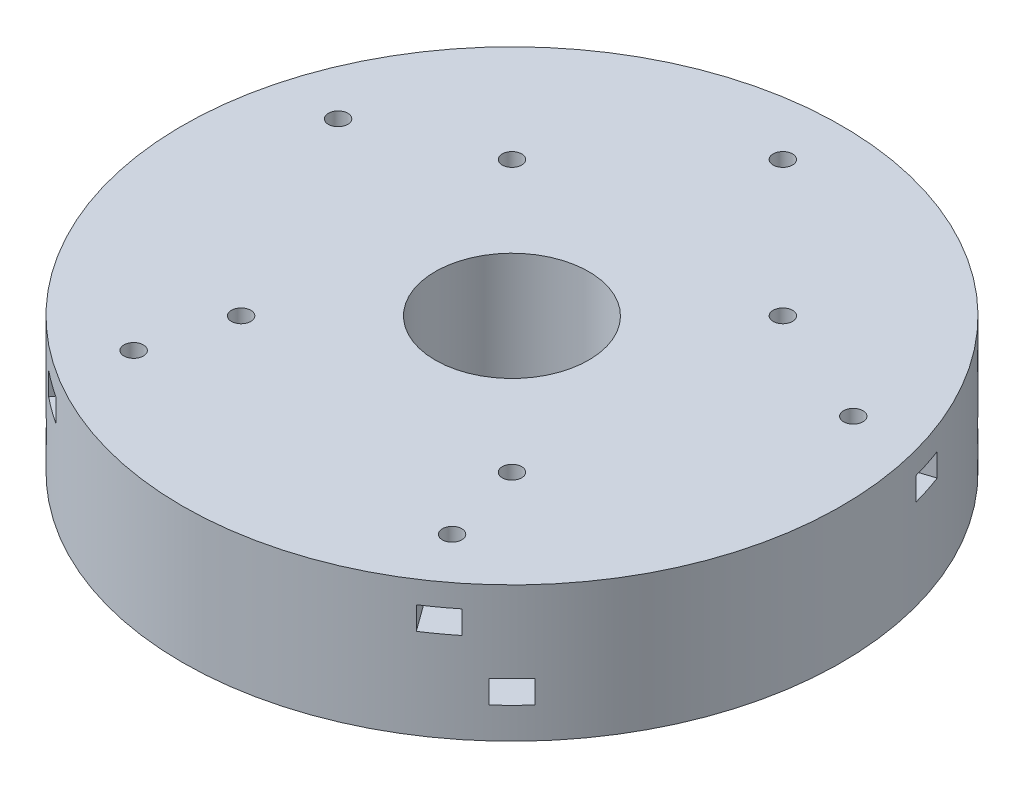
from build123d import *

# Parameters (mm, degrees)
SKETCH1_R           = 73
SKETCH1_R_2         = 2.15
BOSS_EXTRUDE1_DEPTH = 30
CUT_EXTRUDE1_START  = -5.1
CUT_EXTRUDE1_DEPTH  = 5.1
CUT_EXTRUDE2_DEPTH  = 5.1
SKETCH5_R           = 17
CUT_EXTRUDE3_DEPTH  = 108.508139227


with BuildPart() as part:
    # Sketch1 → Boss-Extrude1 (new body)
    with BuildSketch(Plane(origin=(0, 0, 0), x_dir=(1, 0, 0), z_dir=(0, 1, 0))):
        Circle(SKETCH1_R)
        with Locations((30, 30)):
            Circle(SKETCH1_R_2, mode=Mode.SUBTRACT)
        with Locations((-30, 30)):
            Circle(SKETCH1_R_2, mode=Mode.SUBTRACT)
        with Locations((30, -30)):
            Circle(SKETCH1_R_2, mode=Mode.SUBTRACT)
        with Locations((-30, -30)):
            Circle(SKETCH1_R_2, mode=Mode.SUBTRACT)
        with Locations((0, 60)):
            Circle(SKETCH1_R_2, mode=Mode.SUBTRACT)
        with Locations((57.063390978, 18.541019662)):
            Circle(SKETCH1_R_2, mode=Mode.SUBTRACT)
        with Locations((35.267115138, -48.541019662)):
            Circle(SKETCH1_R_2, mode=Mode.SUBTRACT)
        with Locations((-35.267115138, -48.541019662)):
            Circle(SKETCH1_R_2, mode=Mode.SUBTRACT)
        with Locations((-57.063390978, 18.541019662)):
            Circle(SKETCH1_R_2, mode=Mode.SUBTRACT)
    extrude(amount=BOSS_EXTRUDE1_DEPTH)

    # Sketch2 → Cut-Extrude1 (cut)
    with BuildSketch(Plane(origin=(0, 12, 0), x_dir=(1, 0, 0), z_dir=(0, 1, 0)).offset(CUT_EXTRUDE1_START)):
        with BuildLine():
            Line((-27.040199894, 27.040199894), (-25.956837865, 31.083362029))
            Line((-25.956837865, 31.083362029), (-28.916637971, 34.043162135))
            Line((-28.916637971, 34.043162135), (-48.991851025, 54.118375189))
            ThreePointArc((-48.991851025, 54.118375189), (-51.618795027, 51.618795027), (-54.118375189, 48.991851025))
            Line((-54.118375189, 48.991851025), (-34.043162135, 28.916637971))
            Line((-34.043162135, 28.916637971), (-31.083362029, 25.956837865))
            Line((-31.083362029, 25.956837865), (-27.040199894, 27.040199894))
        make_face()
        with BuildLine():
            Line((28.916637971, 34.043162135), (25.956837865, 31.083362029))
            Line((25.956837865, 31.083362029), (27.040199894, 27.040199894))
            Line((27.040199894, 27.040199894), (31.083362029, 25.956837865))
            Line((31.083362029, 25.956837865), (34.043162135, 28.916637971))
            Line((34.043162135, 28.916637971), (54.118375189, 48.991851025))
            ThreePointArc((54.118375189, 48.991851025), (51.618795027, 51.618795027), (48.991851025, 54.118375189))
            Line((48.991851025, 54.118375189), (28.916637971, 34.043162135))
        make_face()
        with BuildLine():
            Line((34.043162135, -28.916637971), (31.083362029, -25.956837865))
            Line((31.083362029, -25.956837865), (27.040199894, -27.040199894))
            Line((27.040199894, -27.040199894), (25.956837865, -31.083362029))
            Line((25.956837865, -31.083362029), (28.916637971, -34.043162135))
            Line((28.916637971, -34.043162135), (48.991851025, -54.118375189))
            ThreePointArc((48.991851025, -54.118375189), (51.618795027, -51.618795027), (54.118375189, -48.991851025))
            Line((54.118375189, -48.991851025), (34.043162135, -28.916637971))
        make_face()
        with BuildLine():
            Line((-28.916637971, -34.043162135), (-25.956837865, -31.083362029))
            Line((-25.956837865, -31.083362029), (-27.040199894, -27.040199894))
            Line((-27.040199894, -27.040199894), (-31.083362029, -25.956837865))
            Line((-31.083362029, -25.956837865), (-34.043162135, -28.916637971))
            Line((-34.043162135, -28.916637971), (-54.118375189, -48.991851025))
            ThreePointArc((-54.118375189, -48.991851025), (-51.618795027, -51.618795027), (-48.991851025, -54.118375189))
            Line((-48.991851025, -54.118375189), (-28.916637971, -34.043162135))
        make_face()
    extrude(amount=CUT_EXTRUDE1_DEPTH, mode=Mode.SUBTRACT)

    # Sketch4 → Cut-Extrude2 (cut)
    with BuildSketch(Plane(origin=(0, 20, 0), x_dir=(1, 0, 0), z_dir=(0, 1, 0))):
        with BuildLine():
            Line((-3.625, 62.092894726), (-3.625, 72.909940166))
            ThreePointArc((-3.625, 72.909940166), (0, 73), (3.625, 72.909940166))
            Line((3.625, 72.909940166), (3.625, 62.092894726))
            Line((3.625, 62.092894726), (3.625, 57.907105274))
            Line((3.625, 57.907105274), (0, 55.814210548))
            Line((0, 55.814210548), (-3.625, 57.907105274))
            Line((-3.625, 57.907105274), (-3.625, 62.092894726))
        make_face()
        with BuildLine():
            Line((56.193116415, 14.446699753), (60.174038749, 15.740179829))
            Line((60.174038749, 15.740179829), (70.461660302, 19.082830699))
            ThreePointArc((70.461660302, 19.082830699), (69.42712569, 22.558240589), (68.221287093, 25.977990442))
            Line((68.221287093, 25.977990442), (57.93366554, 22.635339572))
            Line((57.93366554, 22.635339572), (53.952743206, 21.341859496))
            Line((53.952743206, 21.341859496), (53.082468644, 17.247539587))
            Line((53.082468644, 17.247539587), (56.193116415, 14.446699753))
        make_face()
        with BuildLine():
            Line((31.104255879, -48.978553801), (33.564601187, -52.364928603))
            Line((33.564601187, -52.364928603), (39.92270097, -61.116102193))
            ThreePointArc((39.92270097, -61.116102193), (42.908323417, -59.058240589), (45.78807418, -56.854659114))
            Line((45.78807418, -56.854659114), (39.429974397, -48.103485524))
            Line((39.429974397, -48.103485524), (36.969629088, -44.717110722))
            Line((36.969629088, -44.717110722), (32.806769829, -45.154644861))
            Line((32.806769829, -45.154644861), (31.104255879, -48.978553801))
        make_face()
        with BuildLine():
            Line((-36.969629088, -44.717110722), (-39.429974397, -48.103485524))
            Line((-39.429974397, -48.103485524), (-45.78807418, -56.854659114))
            ThreePointArc((-45.78807418, -56.854659114), (-42.908323417, -59.058240589), (-39.92270097, -61.116102193))
            Line((-39.92270097, -61.116102193), (-33.564601187, -52.364928603))
            Line((-33.564601187, -52.364928603), (-31.104255879, -48.978553801))
            Line((-31.104255879, -48.978553801), (-32.806769829, -45.154644861))
            Line((-32.806769829, -45.154644861), (-36.969629088, -44.717110722))
        make_face()
        with BuildLine():
            Line((-53.952743206, 21.341859496), (-57.93366554, 22.635339572))
            Line((-57.93366554, 22.635339572), (-68.221287093, 25.977990442))
            ThreePointArc((-68.221287093, 25.977990442), (-69.42712569, 22.558240589), (-70.461660302, 19.082830699))
            Line((-70.461660302, 19.082830699), (-60.174038749, 15.740179829))
            Line((-60.174038749, 15.740179829), (-56.193116415, 14.446699753))
            Line((-56.193116415, 14.446699753), (-53.082468644, 17.247539587))
            Line((-53.082468644, 17.247539587), (-53.952743206, 21.341859496))
        make_face()
    extrude(amount=CUT_EXTRUDE2_DEPTH, mode=Mode.SUBTRACT)

    # Sketch5 → Cut-Extrude3 (cut, through all)
    with BuildSketch(Plane(origin=(0, 30, 0), x_dir=(1, 0, 0), z_dir=(0, 1, 0))):
        Circle(SKETCH5_R)
    extrude(amount=-CUT_EXTRUDE3_DEPTH, mode=Mode.SUBTRACT)


solid = part.part
